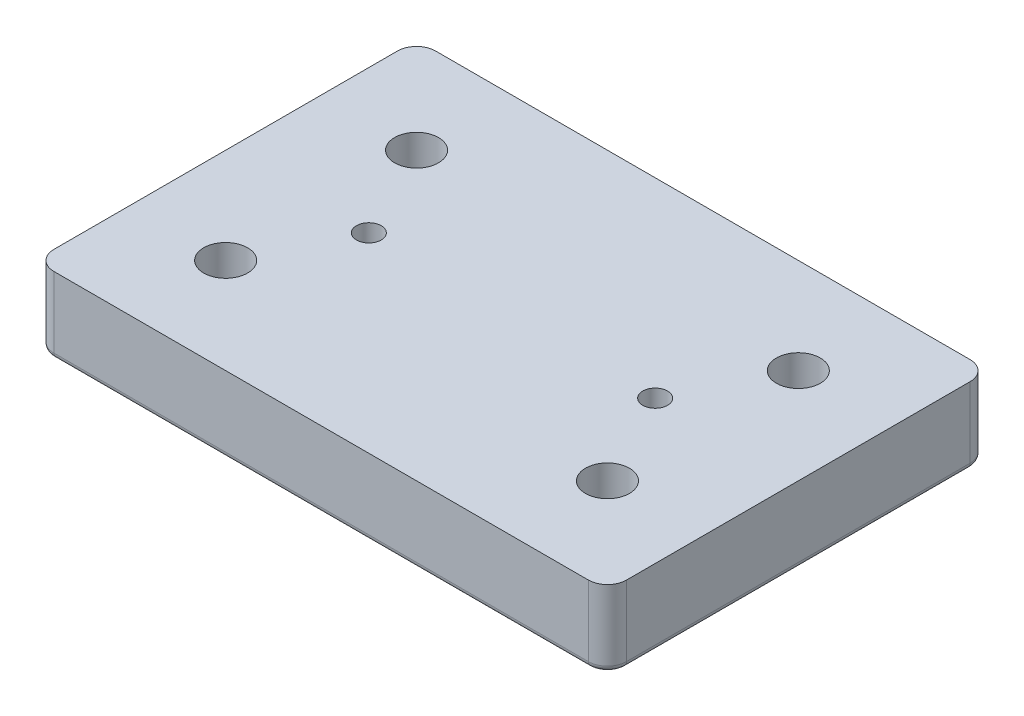
from build123d import *

# Parameters (mm, degrees)
SKETCH3_W           = 30
SKETCH3_H           = 20
SKETCH3_R           = 0.65
BOSS_EXTRUDE5_DEPTH = 4
CUT_EXTRUDE1_DEPTH  = 2
FILLET1_R           = 0.3
FILLET2_R           = 1
SKETCH10_R          = 1.15
SKETCH10_R_2        = 0.65
CUT_EXTRUDE3_DEPTH  = 10
FILLET3_R           = 1


with BuildPart() as part:
    # Sketch3 → Boss-Extrude5 (new body)
    with BuildSketch(Plane(origin=(0, 0, 0), x_dir=(1, 0, 0), z_dir=(0, 1, 0))):
        Rectangle(SKETCH3_W, SKETCH3_H)
        with Locations(Location((7.5, 0, 0), (0, 0, 270))):
            Circle(SKETCH3_R, mode=Mode.SUBTRACT)
        with Locations(Location((-7.5, 0, 0), (0, 0, 90))):
            Circle(SKETCH3_R, mode=Mode.SUBTRACT)
    extrude(amount=BOSS_EXTRUDE5_DEPTH)

    # Sketch6 → Cut-Extrude1 (cut)
    with BuildSketch(Plane(origin=(0, 4, 0), x_dir=(1, 0, 0), z_dir=(0, 1, 0))):
        with BuildLine():
            Line((-8.85, 5), (-10, 5))
            Line((-10, 5), (-10, 3.85))
            ThreePointArc((-10, 3.85), (-9.186827202, 4.186827202), (-8.85, 5))
        make_face()
        with BuildLine():
            Line((-10, 3.85), (-10, 5))
            Line((-10, 5), (-8.85, 5))
            ThreePointArc((-8.85, 5), (-10.813172798, 5.813172798), (-10, 3.85))
        make_face()
        with BuildLine():
            ThreePointArc((11.15, 5), (10, 6.15), (8.85, 5))
            Line((8.85, 5), (10, 5))
            Line((10, 5), (10, 3.85))
            ThreePointArc((10, 3.85), (10.813172798, 4.186827202), (11.15, 5))
        make_face()
        with BuildLine():
            Line((10, 5), (8.85, 5))
            ThreePointArc((8.85, 5), (9.186827202, 4.186827202), (10, 3.85))
            Line((10, 3.85), (10, 5))
        make_face()
        with BuildLine():
            ThreePointArc((10, -3.85), (9.186827202, -4.186827202), (8.85, -5))
            Line((8.85, -5), (10, -5))
            Line((10, -5), (10, -3.85))
        make_face()
        with BuildLine():
            Line((10, -5), (8.85, -5))
            ThreePointArc((8.85, -5), (10, -6.15), (11.15, -5))
            ThreePointArc((11.15, -5), (10.813172798, -4.186827202), (10, -3.85))
            Line((10, -3.85), (10, -5))
        make_face()
        with BuildLine():
            ThreePointArc((-8.85, -5), (-9.186827202, -4.186827202), (-10, -3.85))
            Line((-10, -3.85), (-10, -5))
            Line((-10, -5), (-8.85, -5))
        make_face()
        with BuildLine():
            Line((-10, -5), (-10, -3.85))
            ThreePointArc((-10, -3.85), (-10.813172798, -5.813172798), (-8.85, -5))
            Line((-8.85, -5), (-10, -5))
        make_face()
    extrude(amount=-CUT_EXTRUDE1_DEPTH, mode=Mode.SUBTRACT)

    # Fillet1
    fillet1_edges = [part.edges().sort_by_distance(p)[0] for p in [
        (0, 0, 10),
        (-15, 0, 0),
        (0, 0, -10),
        (15, 0, 0),
    ]]
    fillet(fillet1_edges, radius=FILLET1_R)

    # Fillet2
    # the kernel refuses this fillet: 1 mm, written as the material it takes off along each edge
    with BuildSketch(Plane(origin=(14, 0, 9), x_dir=(1, 0, 0), z_dir=(0, 0, -1))) as fillet2_piece_1:
        with BuildLine():
            CenterArc((0.7, -0.3), 0.3, 0, 90)
            Line((1, -0.3), (1, 0))
            Line((1, 0), (0.7, 0))
        make_face()
    revolve(axis=Axis((14, 0, 9), (0, -1, 0)), revolution_arc=90, mode=Mode.SUBTRACT)
    with BuildSketch(Plane(origin=(14, 0, -9), x_dir=(0, 0, -1), z_dir=(-1, 0, 0))) as fillet2_piece_2:
        with BuildLine():
            CenterArc((0.7, -0.3), 0.3, 0, 90)
            Line((1, -0.3), (1, 0))
            Line((1, 0), (0.7, 0))
        make_face()
    revolve(axis=Axis((14, 0, -9), (0, -1, 0)), revolution_arc=90, mode=Mode.SUBTRACT)
    with BuildSketch(Plane(origin=(15, 0, 10), x_dir=(-1, 0, 0), z_dir=(0, 1, 0)), Plane(origin=(15, 0, -10), x_dir=(0, 0, 1), z_dir=(0, 1, 0))) as fillet2_piece_3:
        with BuildLine():
            CenterArc((FILLET2_R, -FILLET2_R), FILLET2_R, 90, 90)
            Line((0, -FILLET2_R), (0, 0))
            Line((0, 0), (FILLET2_R, 0))
        make_face()
    extrude(amount=6.5, mode=Mode.SUBTRACT)

    # Sketch10 → Cut-Extrude3 (cut)
    with BuildSketch(Plane(origin=(0, 2, 0), x_dir=(1, 0, 0), z_dir=(0, 1, 0))):
        with Locations(Location((10, -5, 0), (0, 0, 270))):
            Circle(SKETCH10_R)
        with Locations(Location((-7.5, 0, 0), (0, 0, 90))):
            Circle(SKETCH10_R_2)
        with Locations(Location((-10, 5, 0), (0, 0, 270))):
            Circle(SKETCH10_R)
        with Locations(Location((7.5, 0, 0), (0, 0, 270))):
            Circle(SKETCH10_R_2)
        with Locations(Location((10, 5, 0), (0, 0, 270))):
            Circle(SKETCH10_R)
        with Locations(Location((-10, -5, 0), (0, 0, 270))):
            Circle(SKETCH10_R)
    extrude(amount=-CUT_EXTRUDE3_DEPTH, mode=Mode.SUBTRACT)

    # Fillet3
    # the kernel refuses this fillet: 1 mm, written as the material it takes off along each edge
    with BuildSketch(Plane(origin=(-14, 0, 9), x_dir=(0, 0, 1), z_dir=(1, 0, 0))) as fillet3_piece_1:
        with BuildLine():
            CenterArc((0.7, -0.3), 0.3, 0, 90)
            Line((1, -0.3), (1, 0))
            Line((1, 0), (0.7, 0))
        make_face()
    revolve(axis=Axis((-14, 0, 9), (0, -1, 0)), revolution_arc=90, mode=Mode.SUBTRACT)
    with BuildSketch(Plane(origin=(-14, 0, -9), x_dir=(-1, 0, 0), z_dir=(0, 0, 1))) as fillet3_piece_2:
        with BuildLine():
            CenterArc((0.7, -0.3), 0.3, 0, 90)
            Line((1, -0.3), (1, 0))
            Line((1, 0), (0.7, 0))
        make_face()
    revolve(axis=Axis((-14, 0, -9), (0, -1, 0)), revolution_arc=90, mode=Mode.SUBTRACT)
    with BuildSketch(Plane(origin=(-15, 0, 10), x_dir=(1, 0, 0), z_dir=(0, 1, 0)), Plane(origin=(-15, 0, -10), x_dir=(0, 0, 1), z_dir=(0, 1, 0))) as fillet3_piece_3:
        with BuildLine():
            CenterArc((FILLET3_R, FILLET3_R), FILLET3_R, 180, 90)
            Line((0, FILLET3_R), (0, 0))
            Line((0, 0), (FILLET3_R, 0))
        make_face()
    extrude(amount=6.5, mode=Mode.SUBTRACT)


solid = part.part
